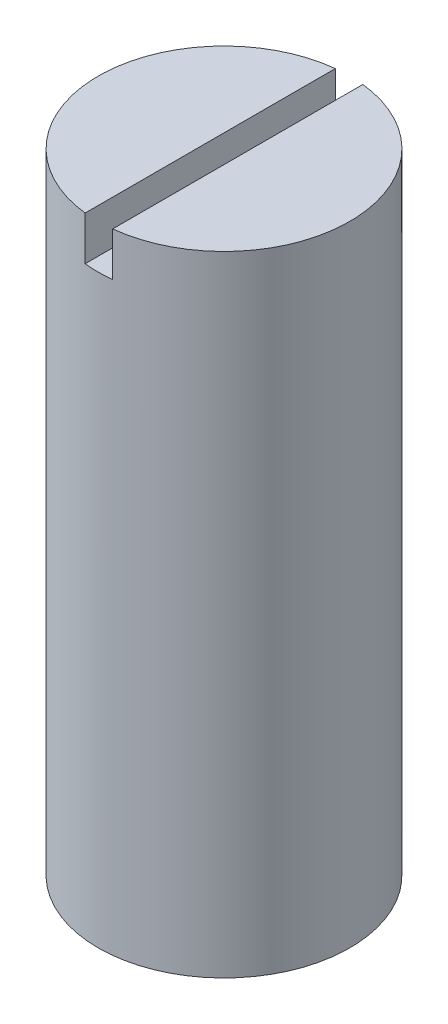
from build123d import *

# Parameters (mm, degrees)
SKETCH1_R           = 16
BOSS_EXTRUDE1_DEPTH = 80
SKETCH2_W           = 3.5
SKETCH2_H           = 7.5875
CUT_EXTRUDE1_DEPTH  = 18


with BuildPart() as part:
    # Sketch1 → Boss-Extrude1 (new body)
    with BuildSketch(Plane(origin=(0, 0, 0), x_dir=(1, 0, 0), z_dir=(0, 1, 0))):
        Circle(SKETCH1_R)
    extrude(amount=BOSS_EXTRUDE1_DEPTH)

    # Sketch2 → Cut-Extrude1 (cut, symmetric)
    with BuildSketch(Plane.XY):
        with Locations((0, 78.20625)):
            Rectangle(SKETCH2_W, SKETCH2_H)
    extrude(amount=CUT_EXTRUDE1_DEPTH, both=True, mode=Mode.SUBTRACT)


solid = part.part
